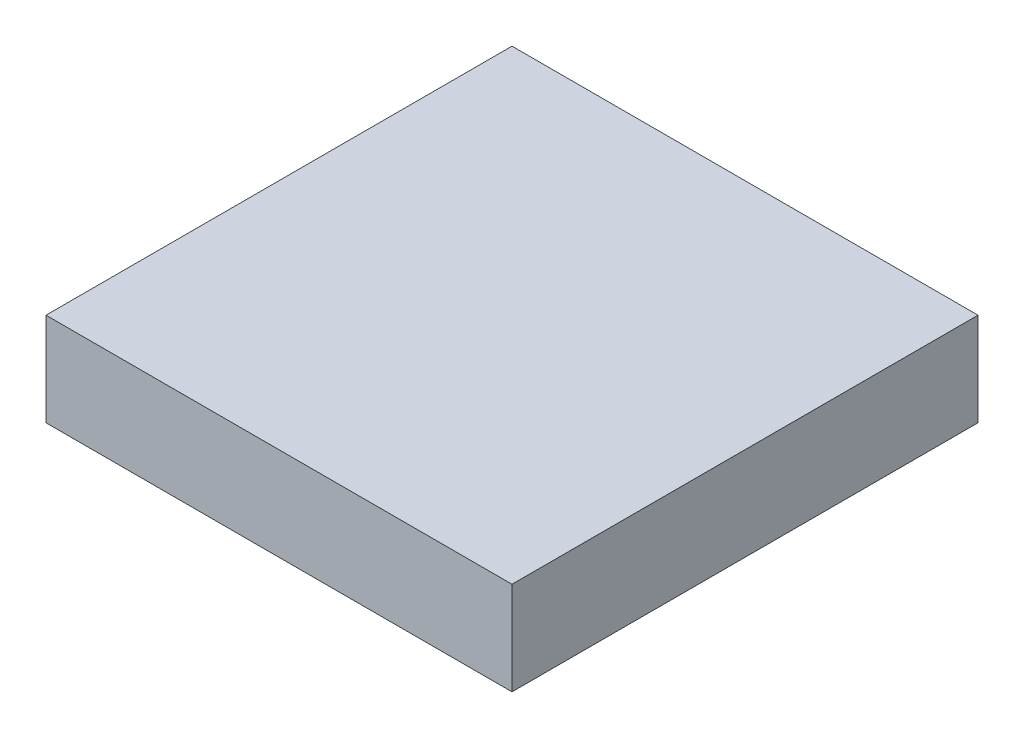
from build123d import *

# Parameters (mm, degrees)
SKETCH1_W           = 15
SKETCH1_H           = 15
SKETCH1_R           = 2.7
BOSS_EXTRUDE1_DEPTH = 5
BOSS_EXTRUDE2_START = 3
SKETCH1_3_W         = 15
SKETCH1_3_H         = 15
SKETCH1_3_R         = 2.7
BOSS_EXTRUDE2_DEPTH = 3
CHAMFER1_SIZE       = 5


with BuildPart() as part:
    # Sketch1 → Boss-Extrude1 (new body)
    # profile 1 of 3: a face of its own
    with BuildSketch(Plane(origin=(0, 0, 0), x_dir=(1, 0, 0), z_dir=(0, 1, 0))):
        Rectangle(SKETCH1_W, SKETCH1_H)
        Circle(SKETCH1_R, mode=Mode.SUBTRACT)
    # profile 2 of 3: a face of its own
    with BuildSketch(Plane(origin=(0, 0, 0), x_dir=(1, 0, 0), z_dir=(0, 1, 0))):
        with BuildLine():
            ThreePointArc((2.097617696, 1.7), (0, 2.7), (-2.097617696, 1.7))
            Line((-2.097617696, 1.7), (2.097617696, 1.7))
        make_face()
    # profile 3 of 3: a face of its own
    with BuildSketch(Plane(origin=(0, 0, 0), x_dir=(1, 0, 0), z_dir=(0, 1, 0))):
        with BuildLine():
            Line((2.097617696, -1.7), (-2.097617696, -1.7))
            ThreePointArc((-2.097617696, -1.7), (0, -2.7), (2.097617696, -1.7))
        make_face()
    extrude(amount=-BOSS_EXTRUDE1_DEPTH)

    # Sketch1<3> → Boss-Extrude2 (add)
    # profile 1 of 4: a face of its own
    with BuildSketch(Plane(origin=(0, 0, 0), x_dir=(1, 0, 0), z_dir=(0, 1, 0)).offset(BOSS_EXTRUDE2_START)):
        Rectangle(SKETCH1_3_W, SKETCH1_3_H)
        Circle(SKETCH1_3_R, mode=Mode.SUBTRACT)
    # profile 2 of 4: a face of its own
    with BuildSketch(Plane(origin=(0, 0, 0), x_dir=(1, 0, 0), z_dir=(0, 1, 0)).offset(BOSS_EXTRUDE2_START)):
        with BuildLine():
            ThreePointArc((2.097617696, 1.7), (0, 2.7), (-2.097617696, 1.7))
            Line((-2.097617696, 1.7), (2.097617696, 1.7))
        make_face()
    # profile 3 of 4: a face of its own
    with BuildSketch(Plane(origin=(0, 0, 0), x_dir=(1, 0, 0), z_dir=(0, 1, 0)).offset(BOSS_EXTRUDE2_START)):
        with BuildLine():
            Line((2.097617696, 1.7), (-2.097617696, 1.7))
            ThreePointArc((-2.097617696, 1.7), (-2.7, 0), (-2.097617696, -1.7))
            Line((-2.097617696, -1.7), (2.097617696, -1.7))
            ThreePointArc((2.097617696, -1.7), (2.54495263, -0.901784958), (2.7, 0))
            ThreePointArc((2.7, 0), (2.54495263, 0.901784958), (2.097617696, 1.7))
        make_face()
    # profile 4 of 4: a face of its own
    with BuildSketch(Plane(origin=(0, 0, 0), x_dir=(1, 0, 0), z_dir=(0, 1, 0)).offset(BOSS_EXTRUDE2_START)):
        with BuildLine():
            Line((2.097617696, -1.7), (-2.097617696, -1.7))
            ThreePointArc((-2.097617696, -1.7), (0, -2.7), (2.097617696, -1.7))
        make_face()
    extrude(amount=-BOSS_EXTRUDE2_DEPTH)

    # Chamfer1
    # the kernel refuses this chamfer: 5 mm, written as the material it takes off along each edge
    with BuildSketch(Plane(origin=(-7.5, -5, 20.35841494), x_dir=(-0.027495876610586317, 0.9996219169112968, 0), z_dir=(0, 0, -1)), Plane(origin=(7.5, -5, -20.35841494), x_dir=(0.027495876610586317, 0.9996219169112968, 0), z_dir=(0, 0, 1)), Plane(origin=(-20.35841494, -5, -7.5), x_dir=(0, 0.9996219169112968, -0.027495876610586317), z_dir=(1, 0, 0))) as chamfer1_piece_1:
        Polygon((CHAMFER1_SIZE * 0.999621916911, CHAMFER1_SIZE * 0.0274958766106), (-CHAMFER1_SIZE * 0.0274958766106, CHAMFER1_SIZE * 0.999621916911), (0, 0), align=None)
    extrude(amount=40.71682988, mode=Mode.SUBTRACT)
    with BuildSketch(Plane(origin=(20.35841494, -5, 7.5), x_dir=(0, -0.027495876610586317, -0.9996219169112968), z_dir=(-1, 0, 0))) as chamfer1_piece_2:
        Polygon((CHAMFER1_SIZE * 0.999621916911, -CHAMFER1_SIZE * 0.0274958766106), (-CHAMFER1_SIZE * 0.0274958766106, -CHAMFER1_SIZE * 0.999621916911), (0, 0), align=None)
    extrude(amount=40.71682988, mode=Mode.SUBTRACT)


solid = part.part
